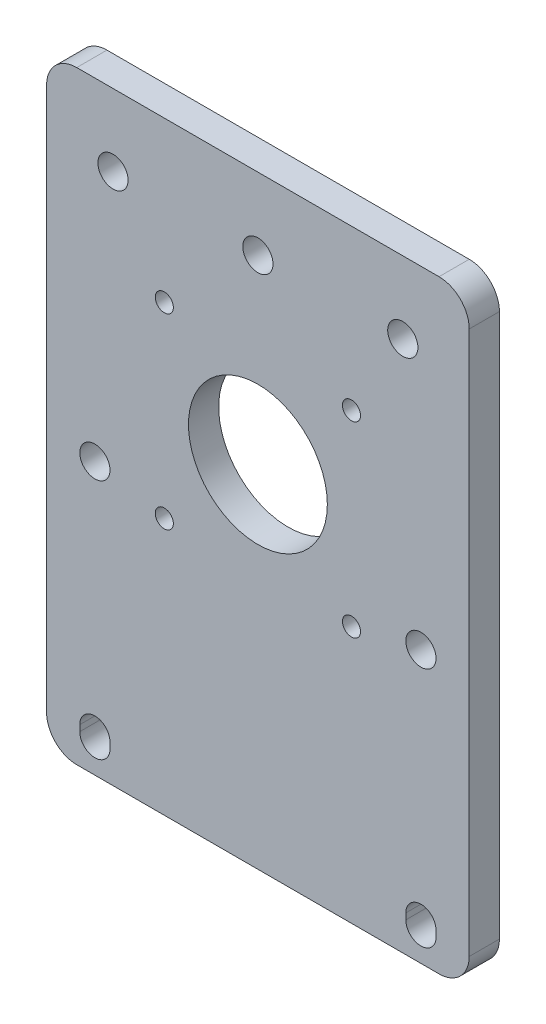
from build123d import *

# Parameters (mm, degrees)
SKETCH4_W           = 70
SKETCH4_H           = 100
SKETCH4_R           = 2.5
BOSS_EXTRUDE2_DEPTH = 5
SKETCH5_R           = 11.5
SKETCH5_R_2         = 1.5
CUT_EXTRUDE2_DEPTH  = 62.23724357
SKETCH6_R           = 2.5
CUT_EXTRUDE3_DEPTH  = 62.23724357
FILLET1_R           = 5


with BuildPart() as part:
    # Sketch4 → Boss-Extrude2 (new body)
    with BuildSketch(Plane.XY):
        Rectangle(SKETCH4_W, SKETCH4_H)
        with Locations((-27, -5)):
            Circle(SKETCH4_R, mode=Mode.SUBTRACT)
        with Locations((27, -5)):
            Circle(SKETCH4_R, mode=Mode.SUBTRACT)
        with BuildLine():
            Line((-24.5, -44), (-24.5, -45))
            ThreePointArc((-24.5, -45), (-27, -47.5), (-29.5, -45))
            Line((-29.5, -45), (-29.5, -44))
            ThreePointArc((-29.5, -44), (-27, -41.5), (-24.5, -44))
        make_face(mode=Mode.SUBTRACT)
        with BuildLine():
            Line((24.5, -44), (24.5, -45))
            ThreePointArc((24.5, -45), (27, -47.5), (29.5, -45))
            Line((29.5, -45), (29.5, -44))
            ThreePointArc((29.5, -44), (27, -41.5), (24.5, -44))
        make_face(mode=Mode.SUBTRACT)
    extrude(amount=BOSS_EXTRUDE2_DEPTH)

    # Sketch5 → Cut-Extrude2 (cut, through all)
    with BuildSketch(Plane.XY.offset(5)):
        with Locations((0, 8.076696831)):
            Circle(SKETCH5_R)
        with Locations((-15.5, 23.576696831)):
            Circle(SKETCH5_R_2)
        with Locations((15.5, 23.576696831)):
            Circle(SKETCH5_R_2)
        with Locations((15.5, -7.423303169)):
            Circle(SKETCH5_R_2)
        with Locations((-15.5, -7.423303169)):
            Circle(SKETCH5_R_2)
    extrude(amount=-CUT_EXTRUDE2_DEPTH, mode=Mode.SUBTRACT)

    # Sketch6 → Cut-Extrude3 (cut, through all)
    with BuildSketch(Plane.XY.offset(5)):
        with Locations((24, 38.076696831)):
            Circle(SKETCH6_R)
        with Locations((-24, 38.076696831)):
            Circle(SKETCH6_R)
        with Locations((0, 38.076696831)):
            Circle(SKETCH6_R)
    extrude(amount=-CUT_EXTRUDE3_DEPTH, mode=Mode.SUBTRACT)

    # Fillet1
    fillet1_edges = [part.edges().sort_by_distance(p)[0] for p in [
        (-35, -50, 2.5),
        (35, -50, 2.5),
        (35, 50, 2.5),
        (-35, 50, 2.5),
    ]]
    fillet(fillet1_edges, radius=FILLET1_R)


solid = part.part
